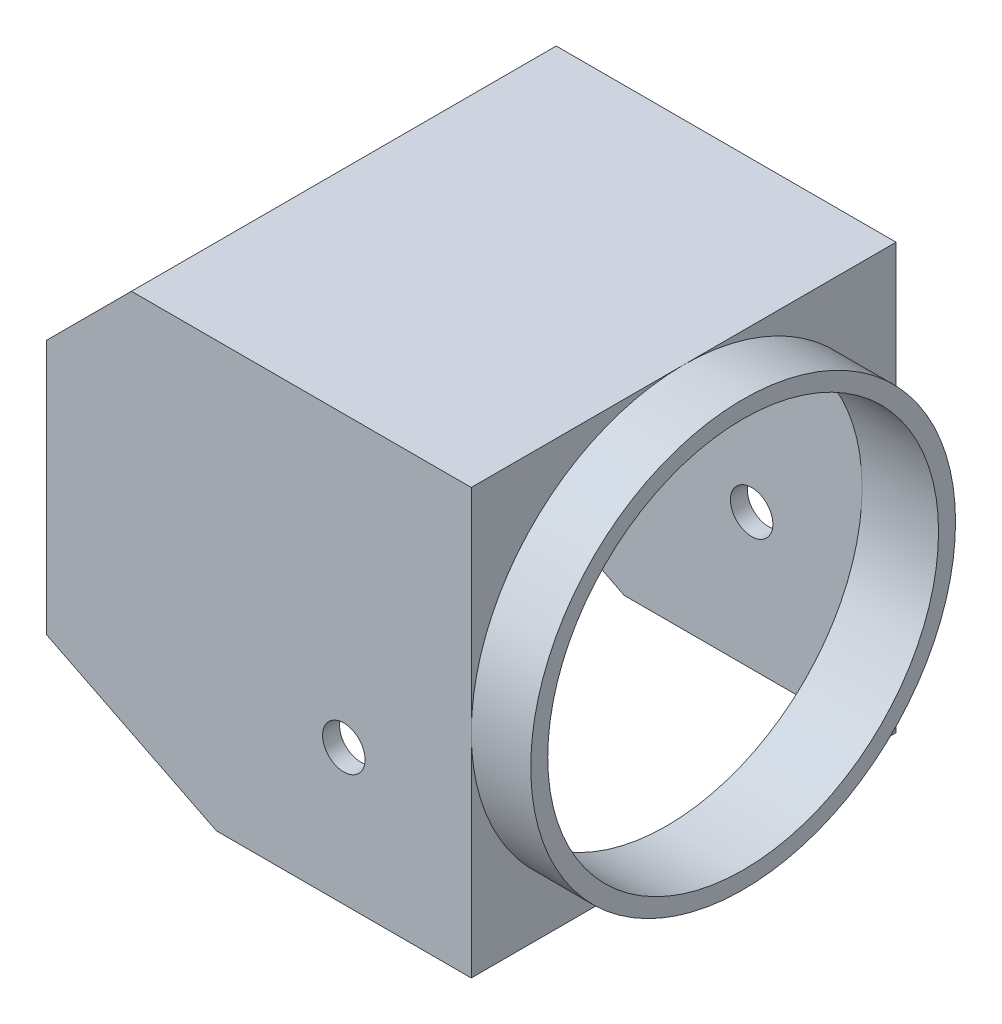
from build123d import *

# Parameters (mm, degrees)
BOSS_EXTRU_1_DEPTH      = 50
ESQUISSE3_R             = 25
BOSS_EXTRU_2_DEPTH      = 7
ESQUISSE4_R             = 2.5
ENL_V_MAT_EXTRU_1_DEPTH = 87.602540378
COQUE1_START            = -39.171572875
COQUE1_OUTLINE_W        = 48
COQUE1_OUTLINE_H        = 46
COQUE1_DEPTH            = 37.171572875
COQUE1_START_2          = -2
COQUE1_2_OUTLINE_R      = 23
COQUE1_2_DEPTH          = 9
COQUE1_START_3          = -48
COQUE1_3_DEPTH          = 15.9452
COQUE1_START_4          = 2
COQUE1_4_DEPTH          = 46


with BuildPart() as part:
    # Esquisse1 → Boss.-Extru.1 (new body)
    with BuildSketch(Plane.XY):
        Polygon((0, 0), (-30, 0), (-50, 10), (-50, 40), (-40, 50), (0, 50), align=None)
    extrude(amount=BOSS_EXTRU_1_DEPTH)

    # Esquisse3 → Boss.-Extru.2 (add)
    with BuildSketch(Plane(origin=(0, 0, 0), x_dir=(0, 0, -1), z_dir=(1, 0, 0))):
        with Locations((-25, 25)):
            Circle(ESQUISSE3_R)
    extrude(amount=BOSS_EXTRU_2_DEPTH)

    # Esquisse4 → Enlèv. mat.-Extru.1 (cut, through all)
    with BuildSketch(Plane.XY.offset(50)):
        with Locations((-15, 16)):
            Circle(ESQUISSE4_R)
    extrude(amount=-ENL_V_MAT_EXTRU_1_DEPTH, mode=Mode.SUBTRACT)

    # Coque1: read off the stored shape, not the designer's step
    # Coque1 outline → Coque1 (cut)
    with BuildSketch(Plane.YZ.offset(COQUE1_START)):
        with Locations((24, 25)):
            Rectangle(COQUE1_OUTLINE_W, COQUE1_OUTLINE_H)
    extrude(amount=COQUE1_DEPTH, mode=Mode.SUBTRACT)

    # Coque1 2 outline → Coque1 2 (cut)
    with BuildSketch(Plane.YZ.offset(COQUE1_START_2)):
        with Locations((25, 25)):
            Circle(COQUE1_2_OUTLINE_R)
    extrude(amount=COQUE1_2_DEPTH, mode=Mode.SUBTRACT)

    # Coque1 3 outline → Coque1 3 (cut)
    with BuildSketch(Plane.YZ.offset(COQUE1_START_3)):
        with BuildLine():
            ThreePointArc((25, 2), (2, 25), (25, 48))
            Line((25, 48), (0, 48))
            Line((0, 48), (0, 2))
            Line((0, 2), (25, 2))
        make_face()
    extrude(amount=COQUE1_3_DEPTH, mode=Mode.SUBTRACT)

    # Coque1 4 outline → Coque1 4 (cut)
    with BuildSketch(Plane.XY.offset(COQUE1_START_4)):
        Polygon((-39.171572875, 48), (-48, 39.171572875), (-48, 9), (-39.171572875, 4.585786437), align=None)
    extrude(amount=COQUE1_4_DEPTH, mode=Mode.SUBTRACT)


solid = part.part
